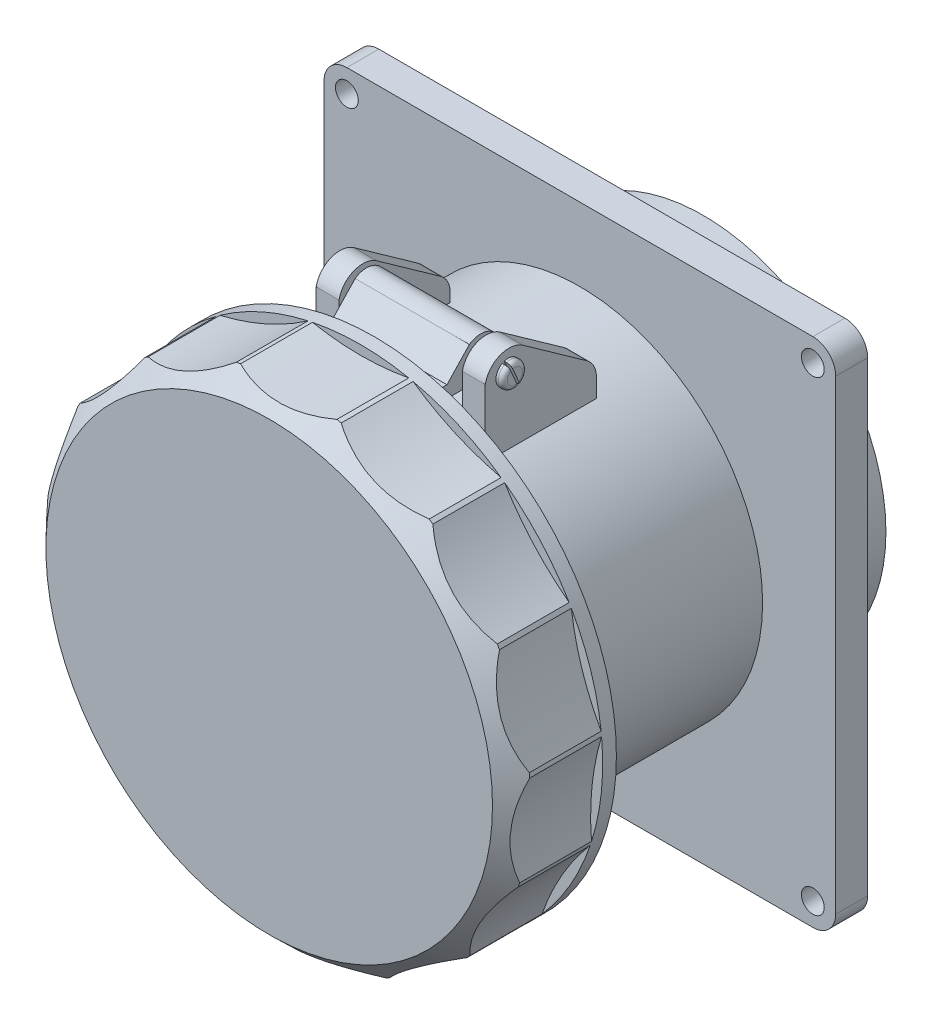
from build123d import *

# Parameters (mm, degrees)
ESBO_O1_R              = 2.5
EXTRUS_O1_DEPTH        = 7
EXTRUS_O2_DEPTH        = 45
ESBO_O3_R              = 53
EXTRUS_O3_DEPTH        = 23
CORTE_EXTRUS_O1_DEPTH  = 20
CIRPATTERN1_COUNT      = 15
EXTRUS_O4_START        = -43.5
ESBO_O5_R              = 2
EXTRUS_O4_DEPTH        = 25
EXTRUS_O5_START        = 1
EXTRUS_O5_DEPTH        = 5
EXTRUS_O6_DEPTH        = 1.5
FILETE1_R              = 1
FILETE1_OF_ESPELHAR2_R = 1
EXTRUS_O7_START        = 20
ESBO_O8_R              = 40
EXTRUS_O7_DEPTH        = 20
ESBO_O9_OUTSIDE_W      = 170.254
ESBO_O9_OUTSIDE_H      = 170.254
ESBO_O9_OUTSIDE_R      = 48.876829662
CORTE_EXTRUS_O2_DEPTH  = 10
CORTE_EXTRUS_O2_DRAFT  = -44


with BuildPart() as part:
    # Esboço1 → Extrusão1 (new body)
    with BuildSketch(Plane.XY):
        with BuildLine():
            Line((-51, 56), (51, 56))
            ThreePointArc((51, 56), (54.535533906, 54.535533906), (56, 51))
            Line((56, 51), (56, -51))
            ThreePointArc((56, -51), (54.535533906, -54.535533906), (51, -56))
            Line((51, -56), (-51, -56))
            ThreePointArc((-51, -56), (-54.535533906, -54.535533906), (-56, -51))
            Line((-56, -51), (-56, 51))
            ThreePointArc((-56, 51), (-54.535533906, 54.535533906), (-51, 56))
        make_face()
        with Locations((-51, 51)):
            Circle(ESBO_O1_R, mode=Mode.SUBTRACT)
        with Locations((51, 51)):
            Circle(ESBO_O1_R, mode=Mode.SUBTRACT)
        with Locations((51, -51)):
            Circle(ESBO_O1_R, mode=Mode.SUBTRACT)
        with Locations((-51, -51)):
            Circle(ESBO_O1_R, mode=Mode.SUBTRACT)
    extrude(amount=EXTRUS_O1_DEPTH)

    # Esboço2 → Extrusão2 (add)
    with BuildSketch(Plane.XY.offset(7)):
        with BuildLine():
            ThreePointArc((7.466968276, -39.296875), (0, 40), (-7.466968276, -39.296875))
            ThreePointArc((-7.466968276, -39.296875), (0, -47.5), (7.466968276, -39.296875))
        make_face()
    extrude(amount=EXTRUS_O2_DEPTH)

    # Esboço3 → Extrusão3 (add)
    with BuildSketch(Plane.XY.offset(52)):
        Circle(ESBO_O3_R)
    extrude(amount=EXTRUS_O3_DEPTH)

    # Esboço4 → Corte-extrusão1 (cut)
    with BuildSketch(Plane.XY.offset(75)):
        with BuildLine():
            Line((-10.54225132, 51.940937006), (-10.54225132, 54.205628294))
            Line((-10.54225132, 54.205628294), (10.54225132, 54.205628294))
            Line((10.54225132, 54.205628294), (10.54225132, 51.940937006))
            ThreePointArc((10.54225132, 51.940937006), (0, 50.942275523), (-10.54225132, 51.940937006))
        make_face()
    corte_extrus_o1 = extrude(amount=-CORTE_EXTRUS_O1_DEPTH, mode=Mode.SUBTRACT)

    # CirPattern1: Corte-extrusão1 ×15 about axis
    cirpattern1_axis = Axis((0, 0, 52), (0, 0, -1))
    for i in range(1, CIRPATTERN1_COUNT):
        add(corte_extrus_o1.rotate(cirpattern1_axis, i * 360 / CIRPATTERN1_COUNT), mode=Mode.SUBTRACT)

    # Esboço5 → Extrusão4 (add)
    with BuildSketch(Plane(origin=(56, 0, 0), x_dir=(0, 0, -1), z_dir=(1, 0, 0)).offset(EXTRUS_O4_START)):
        with BuildLine():
            Line((-52, 48.425161424), (-48.590061305, 48.425161424))
            Line((-48.590061305, 48.425161424), (-43.681255504, 53.601126114))
            ThreePointArc((-43.681255504, 53.601126114), (-37.105802949, 51.376736013), (-41.208427675, 45.7773648))
            Line((-41.208427675, 45.7773648), (-52, 45.7773648))
            Line((-52, 45.7773648), (-53.584045292, 45.7773648))
            Line((-53.584045292, 45.7773648), (-53.584045292, 48.425161424))
            Line((-53.584045292, 48.425161424), (-52, 48.425161424))
        make_face()
        with Locations((-41.208427675, 50.080034314)):
            Circle(ESBO_O5_R, mode=Mode.SUBTRACT)
    extrude(amount=-EXTRUS_O4_DEPTH)

    # Esboço6 → Extrusão5 (add)
    with BuildSketch(Plane(origin=(12.5, 0, 0), x_dir=(0, 0, -1), z_dir=(1, 0, 0)).offset(EXTRUS_O5_START)):
        with BuildLine():
            Line((-46.209714781, 50.276534355), (-46.209714781, 26.165155357))
            Line((-46.209714781, 26.165155357), (-21.876287563, 26.165155357))
            Line((-21.876287563, 26.165155357), (-21.876287563, 39.594135787))
            ThreePointArc((-21.876287563, 39.594135787), (-22.43356005, 41.888078298), (-23.981156461, 43.67068039))
            Line((-23.981156461, 43.67068039), (-37.956764564, 53.596051418))
            ThreePointArc((-37.956764564, 53.596051418), (-42.989920462, 54.190473621), (-46.209714781, 50.276534355))
        make_face()
    extrus_o5 = extrude(amount=EXTRUS_O5_DEPTH)

    # Espelhar1: Extrusão5 across plane
    add(extrus_o5.mirror(Plane(origin=(0, 0, 0), x_dir=(0, 0, 1), z_dir=(1, 0, 0))))

    # Esboço7 → Extrusão6 (add)
    with BuildSketch(Plane(origin=(18.5, 0, 0), x_dir=(0, 0, -1), z_dir=(1, 0, 0))):
        with BuildLine():
            Line((-42.48547616, 52.414398862), (-40.3906817, 47.547959631))
            ThreePointArc((-40.3906817, 47.547959631), (-43.652460694, 49.027982375), (-42.48547616, 52.414398862))
        make_face()
        with BuildLine():
            Line((-39.962056908, 47.729147121), (-42.059260748, 52.601183607))
            ThreePointArc((-42.059260748, 52.601183607), (-38.764394656, 51.132086253), (-39.962056908, 47.729147121))
        make_face()
    extrus_o6 = extrude(amount=EXTRUS_O6_DEPTH)

    # Filete1
    filete1_edges = [part.edges().sort_by_distance(p)[0] for p in [
        (20, 51.132086253, 38.764394656),
        (20, 49.027982375, 43.652460694),
    ]]
    fillet(filete1_edges, radius=FILETE1_R)

    # Espelhar2: Extrusão6 across plane
    add(extrus_o6.mirror(Plane(origin=(0, 0, 0), x_dir=(0, 0, 1), z_dir=(1, 0, 0))))

    # Filete1 of Espelhar2
    filete1_of_espelhar2_edges = [part.edges().sort_by_distance(p)[0] for p in [
        (-20, 51.132086253, 38.764394656),
        (-20, 49.027982375, 43.652460694),
    ]]
    fillet(filete1_of_espelhar2_edges, radius=FILETE1_OF_ESPELHAR2_R)

    # Esboço8 → Extrusão7 (add)
    with BuildSketch(Plane(origin=(0, 0, 0), x_dir=(-1, 0, 0), z_dir=(0, 0, -1)).offset(EXTRUS_O7_START)):
        Circle(ESBO_O8_R)
    extrude(amount=-EXTRUS_O7_DEPTH)


with BuildPart() as corte_extrus_o2_tool:
    # Esboço9 outside → Corte-extrusão2 (with draft: the straight prism first)
    with BuildSketch(Plane.XY.offset(75)):
        Rectangle(ESBO_O9_OUTSIDE_W, ESBO_O9_OUTSIDE_H)
        Circle(ESBO_O9_OUTSIDE_R, mode=Mode.SUBTRACT)
    extrude(amount=-CORTE_EXTRUS_O2_DEPTH)
    # Corte-extrusão2: the draft: its side faces are tilted about the plane it starts from
    corte_extrus_o2_sides = [corte_extrus_o2_tool.faces().sort_by_distance(p)[0] for p in [
        (0, -85.127, 70),
        (85.127, 0, 70),
        (0, 85.127, 70),
        (-85.127, 0, 70),
        (-48.876829662, 0, 70),
    ]]
    draft(corte_extrus_o2_sides, Plane.XY.offset(75), CORTE_EXTRUS_O2_DRAFT)


with BuildPart() as part_1:
    add(part.part)

    # Corte-extrusão2: cut by corte_extrus_o2_tool
    add(corte_extrus_o2_tool.part, mode=Mode.SUBTRACT)


solid = part_1.part
